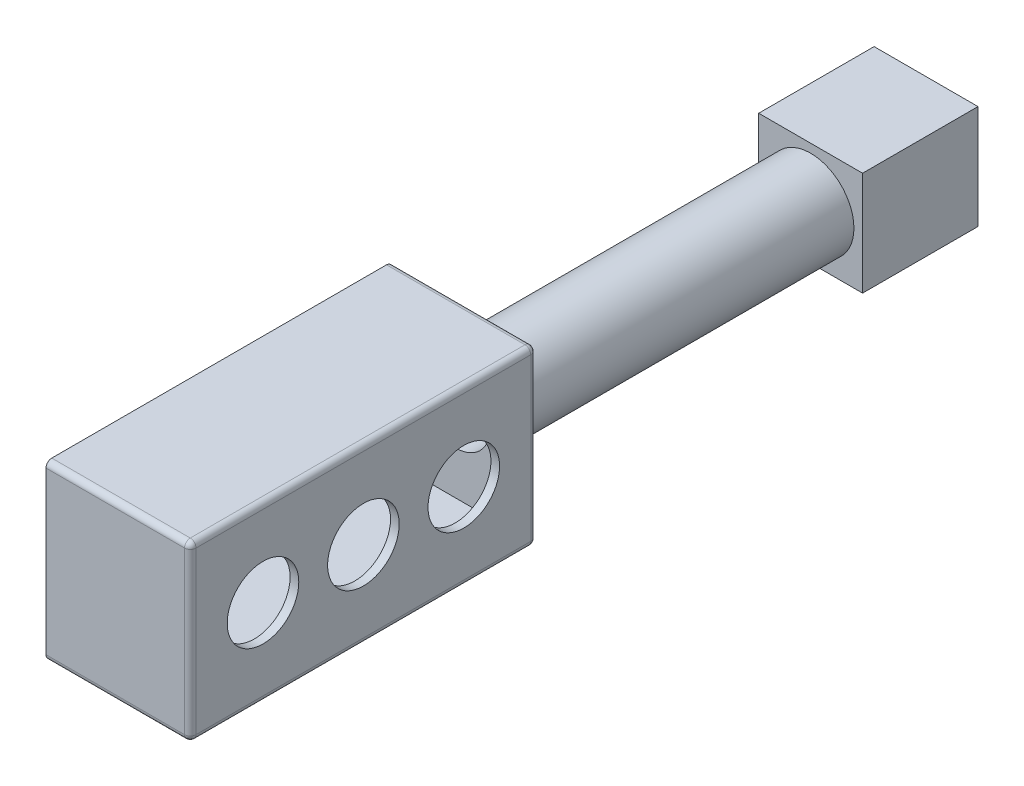
from build123d import *

# Parameters (mm, degrees)
SKETCH_1_R          = 7.5
EXTRUDE_1_DEPTH     = 60
SHELL_3_T           = -1.5
SKETCH_4_W          = 25
SKETCH_4_H          = 30
EXTRUDE_4_DEPTH     = 60
SHELL_START         = 61.5
SHELL_4_OUTLINE_W   = 23.5
SHELL_4_OUTLINE_H   = 27
SHELL_4_DEPTH       = 57
SHELL_START_2       = 60
SHELL_4_2_OUTLINE_R = 6
SHELL_4_2_DEPTH     = 1.5
SKETCH_5_R          = 6.2
CUT_EXTRUDE_1_DEPTH = 1.5
SKETCH_18_W         = 18
SKETCH_18_H         = 18
EXTRUDE_10_DEPTH    = 20
SKETCH_19_W         = 15
SKETCH_19_H         = 15
CUT_EXTRUDE_5_DEPTH = 17
SKETCH_20_R         = 6
CUT_EXTRUDE_6_DEPTH = 1.5
SKETCH_22_R         = 7.5
CUT_EXTRUDE_7_DEPTH = 1.5
FILLET_5_R          = 1


# Read off the part's stored shape, not the designer's step: 抽壳4
with BuildPart() as part:
    # 草图1 → 凸台-拉伸1 (new body)
    with BuildSketch(Plane.XY):
        Circle(SKETCH_1_R)
    extrude(amount=EXTRUDE_1_DEPTH)

    # 抽壳3
    shell_3_openings = [part.faces().sort_by_distance(p)[0] for p in [
        (0, 0, 60),
        (0, 0, 0),
    ]]
    offset(amount=SHELL_3_T, openings=shell_3_openings, kind=Kind.INTERSECTION)

    # 草图4 → 凸台-拉伸4 (add)
    with BuildSketch(Plane.XY.offset(60)):
        Rectangle(SKETCH_4_W, SKETCH_4_H)
    extrude(amount=EXTRUDE_4_DEPTH)

    # 抽壳4 outline → 抽壳4 (cut)
    with BuildSketch(Plane.XY.offset(SHELL_START)):
        with Locations((-0.75, 0)):
            Rectangle(SHELL_4_OUTLINE_W, SHELL_4_OUTLINE_H)
    extrude(amount=SHELL_4_DEPTH, mode=Mode.SUBTRACT)

    # Shell 4 2 outline → Shell 4 2 (cut)
    with BuildSketch(Plane.XY.offset(SHELL_START_2)):
        Circle(SHELL_4_2_OUTLINE_R)
    extrude(amount=SHELL_4_2_DEPTH, mode=Mode.SUBTRACT)

    # 草图5 → 切除-拉伸1 (cut)
    with BuildSketch(Plane(origin=(12.5, 0, 0), x_dir=(0, 0, -1), z_dir=(1, 0, 0))):
        with Locations((-90, 0)):
            Circle(SKETCH_5_R)
        with Locations((-107.4, 0)):
            Circle(SKETCH_5_R)
        with Locations(Location((-72.6, 0, 0), (0, 0, 180))):
            Circle(SKETCH_5_R)
    extrude(amount=-CUT_EXTRUDE_1_DEPTH, mode=Mode.SUBTRACT)

    # 草图18 → 凸台-拉伸10 (add)
    with BuildSketch(Plane.XY):
        Rectangle(SKETCH_18_W, SKETCH_18_H)
    extrude(amount=-EXTRUDE_10_DEPTH)

    # 草图19 → 切除-拉伸5 (cut)
    with BuildSketch(Plane.XY.offset(-1.5)):
        Rectangle(SKETCH_19_W, SKETCH_19_H)
    extrude(amount=-CUT_EXTRUDE_5_DEPTH, mode=Mode.SUBTRACT)

    # 草图20 → 切除-拉伸6 (cut)
    with BuildSketch(Plane.XY.offset(-1.5)):
        with Locations(Location((0, 0, 0), (0, 0, 180))):
            Circle(SKETCH_20_R)
    extrude(amount=CUT_EXTRUDE_6_DEPTH, mode=Mode.SUBTRACT)

    # 草图22 → 切除-拉伸7 (cut)
    with BuildSketch(Plane(origin=(0, -9, 0), x_dir=(-1, 0, 0), z_dir=(0, -1, 0))):
        with Locations(Location((0, 10, 0), (0, 0, 90))):
            Circle(SKETCH_22_R)
    extrude(amount=-CUT_EXTRUDE_7_DEPTH, mode=Mode.SUBTRACT)

    # 圆角5
    fillet_5_edges = [part.edges().sort_by_distance(p)[0] for p in [
        (12.5, 0, 60),
        (12.5, -15, 90),
        (0, 15, 60),
        (12.5, 15, 90),
        (0, -15, 60),
        (12.5, 0, 120),
        (0, 15, 120),
        (0, -15, 120),
    ]]
    fillet(fillet_5_edges, radius=FILLET_5_R)


solid = part.part
